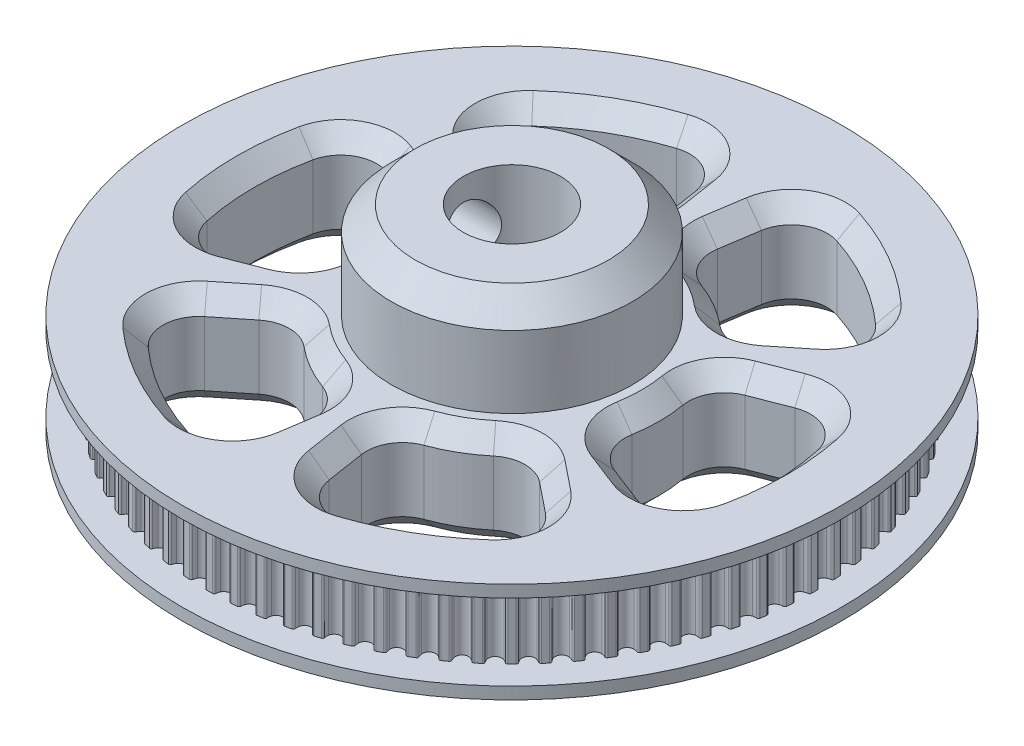
from build123d import *

# Parameters (mm, degrees)
SKETCH1_R               = 25.464790895
BOSS_EXTRUDE1_DEPTH     = 3.175
CUT_EXTRUDE1_DEPTH      = 37.152341219
CIRPATTERN1_COUNT       = 80
BOSS_EXTRUDE2_START     = 3.175
SKETCH3_R               = 27.464790895
BOSS_EXTRUDE2_DEPTH     = 1
BOSS_EXTRUDE3_START     = -4.175
SKETCH3_2_R             = 27.464790895
BOSS_EXTRUDE3_DEPTH     = 1
CUT_EXTRUDE2_DEPTH      = 40.064819247
CUT_EXTRUDE2_DEPTH_BACK = 40.064819247
SKETCH4_R               = 4.05
CUT_EXTRUDE3_DEPTH      = 40.064819247
CUT_EXTRUDE3_DEPTH_BACK = 40.064819247
FILLET2_R               = 3
CHAMFER1_SIZE           = 1.5
BOSS_EXTRUDE4_START     = 8
SKETCH6_R               = 10.05
SKETCH6_R_2             = 4.05
BOSS_EXTRUDE4_DEPTH     = 8
CUT_EXTRUDE4_REACH      = 42.705
CUT_EXTRUDE4_END_RADIUS = 10.05
SKETCH7_R               = 2.403599608
CHAMFER2_SIZE           = 2


with BuildPart() as part:
    # Sketch1 → Boss-Extrude1 (new, symmetric)
    with BuildSketch(Plane(origin=(0, 0, 0), x_dir=(1, 0, 0), z_dir=(0, 1, 0))):
        with Locations(Location((0, 0, 0), (0, 0, 270))):
            Circle(SKETCH1_R)
    extrude(amount=BOSS_EXTRUDE1_DEPTH, both=True)

    # Sketch2 → Cut-Extrude1 (cut, symmetric)
    with BuildSketch(Plane(origin=(0, 0, 0), x_dir=(1, 0, 0), z_dir=(0, 1, 0))):
        with BuildLine():
            Line((0, 25.210790895), (0, 25.464790895))
            ThreePointArc((0, 25.464790895), (0.999742999, 25.445158464), (1.997944466, 25.386291443))
            Line((1.997944466, 25.386291443), (1.978015856, 25.13307444))
            ThreePointArc((1.978015856, 25.13307444), (1.855662402, 25.142404312), (1.733264986, 25.151138543))
            ThreePointArc((1.733264986, 25.151138543), (1.631053055, 25.120045225), (1.575460914, 25.028811529))
            ThreePointArc((1.575460914, 25.028811529), (1.533948478, 24.874656845), (1.468433356, 24.729072788))
            ThreePointArc((1.468433356, 24.729072788), (0.960326144, 24.441932511), (0.476314023, 24.768053263))
            ThreePointArc((0.476314023, 24.768053263), (0.422423256, 24.91832879), (0.393133626, 25.075265295))
            ThreePointArc((0.393133626, 25.075265295), (0.344870971, 25.170579456), (0.245413678, 25.20959638))
            ThreePointArc((0.245413678, 25.20959638), (0.122708293, 25.210492264), (0, 25.210790895))
        make_face()
    cut_extrude1 = extrude(amount=CUT_EXTRUDE1_DEPTH, both=True, mode=Mode.SUBTRACT)

    # CirPattern1: Cut-Extrude1 ×80 about axis
    cirpattern1_axis = Axis((0, 0, 0), (0, 1, 0))
    for i in range(1, CIRPATTERN1_COUNT):
        add(cut_extrude1.rotate(cirpattern1_axis, i * 360 / CIRPATTERN1_COUNT), mode=Mode.SUBTRACT)

    # Sketch3 → Boss-Extrude2 (add)
    with BuildSketch(Plane(origin=(0, 0, 0), x_dir=(1, 0, 0), z_dir=(0, 1, 0)).offset(BOSS_EXTRUDE2_START)):
        with Locations(Location((0, 0, 0), (0, 0, 270))):
            Circle(SKETCH3_R)
    extrude(amount=BOSS_EXTRUDE2_DEPTH)

    # Sketch3<2> → Boss-Extrude3 (add)
    with BuildSketch(Plane(origin=(0, 0, 0), x_dir=(1, 0, 0), z_dir=(0, 1, 0)).offset(BOSS_EXTRUDE3_START)):
        with Locations(Location((0, 0, 0), (0, 0, 270))):
            Circle(SKETCH3_2_R)
    extrude(amount=BOSS_EXTRUDE3_DEPTH)

    # Sketch4 → Cut-Extrude2 (cut, two sides: drawn at the far end of the back side and taken through both)
    with BuildSketch(Plane(origin=(0, 0, 0), x_dir=(1, 0, 0), z_dir=(0, 1, 0)).offset(-CUT_EXTRUDE2_DEPTH_BACK)):
        with Locations(Location((0, 0, 0), (0, 0, 270))):
            Circle(SKETCH4_R)
    extrude(amount=CUT_EXTRUDE2_DEPTH + CUT_EXTRUDE2_DEPTH_BACK, mode=Mode.SUBTRACT)

    # Sketch5 → Cut-Extrude3 (cut, two sides: drawn at the far end of the back side and taken through both)
    with BuildSketch(Plane(origin=(0, 0, 0), x_dir=(1, 0, 0), z_dir=(0, 1, 0)).offset(-CUT_EXTRUDE3_DEPTH_BACK)):
        with BuildLine():
            ThreePointArc((-9.590119923, 7.701921829), (-6.15, 10.652112467), (-1.875, 12.156248393))
            Line((-1.875, 12.156248393), (-3.272071783, 21.213929254))
            ThreePointArc((-3.272071783, 21.213929254), (-10.732395447, 18.589054202), (-16.735765757, 13.440661914))
            Line((-16.735765757, 13.440661914), (-9.590119923, 7.701921829))
        make_face()
        with BuildLine():
            Line((3.272071783, 21.213929254), (1.875, 12.156248393))
            ThreePointArc((1.875, 12.156248393), (6.15, 10.652112467), (9.590119923, 7.701921829))
            Line((9.590119923, 7.701921829), (16.735765757, 13.440661914))
            ThreePointArc((16.735765757, 13.440661914), (10.732395447, 18.589054202), (3.272071783, 21.213929254))
        make_face()
        with BuildLine():
            Line((20.00783754, 7.77326734), (11.465119923, 4.454326565))
            ThreePointArc((11.465119923, 4.454326565), (12.089478381, 2.265946264), (12.3, 0))
            ThreePointArc((12.3, 0), (12.089478381, -2.265946264), (11.465119923, -4.454326565))
            Line((11.465119923, -4.454326565), (20.00783754, -7.77326734))
            ThreePointArc((20.00783754, -7.77326734), (21.097408575, -3.954314044), (21.464790895, 0))
            ThreePointArc((21.464790895, 0), (21.097408575, 3.954314044), (20.00783754, 7.77326734))
        make_face()
        with BuildLine():
            Line((-20.00783754, -7.77326734), (-11.465119923, -4.454326565))
            ThreePointArc((-11.465119923, -4.454326565), (-12.3, 0), (-11.465119923, 4.454326565))
            Line((-11.465119923, 4.454326565), (-20.00783754, 7.77326734))
            ThreePointArc((-20.00783754, 7.77326734), (-21.464790895, 0), (-20.00783754, -7.77326734))
        make_face()
        with BuildLine():
            Line((-3.272071783, -21.213929254), (-1.875, -12.156248393))
            ThreePointArc((-1.875, -12.156248393), (-6.15, -10.652112467), (-9.590119923, -7.701921829))
            Line((-9.590119923, -7.701921829), (-16.735765757, -13.440661914))
            ThreePointArc((-16.735765757, -13.440661914), (-10.732395447, -18.589054202), (-3.272071783, -21.213929254))
        make_face()
        with BuildLine():
            Line((16.735765757, -13.440661914), (9.590119923, -7.701921829))
            ThreePointArc((9.590119923, -7.701921829), (6.15, -10.652112467), (1.875, -12.156248393))
            Line((1.875, -12.156248393), (3.272071783, -21.213929254))
            ThreePointArc((3.272071783, -21.213929254), (10.732395447, -18.589054202), (16.735765757, -13.440661914))
        make_face()
    extrude(amount=CUT_EXTRUDE3_DEPTH + CUT_EXTRUDE3_DEPTH_BACK, mode=Mode.SUBTRACT)

    # Fillet2
    fillet2_edges = [part.edges().sort_by_distance(p)[0] for p in [
        (11.465119923, 0, 4.454326565),
        (11.465119923, 0, -4.454326565),
        (20.00783754, 0, -7.77326734),
        (20.00783754, 0, 7.77326734),
        (9.590119923, 0, -7.701921829),
        (1.875, 0, -12.156248393),
        (3.272071783, 0, -21.213929254),
        (16.735765757, 0, -13.440661914),
        (-9.590119923, 0, 7.701921829),
        (-1.875, 0, 12.156248393),
        (-3.272071783, 0, 21.213929254),
        (-16.735765757, 0, 13.440661914),
        (-11.465119923, 0, -4.454326565),
        (-11.465119923, 0, 4.454326565),
        (-20.00783754, 0, 7.77326734),
        (-20.00783754, 0, -7.77326734),
        (1.875, 0, 12.156248393),
        (9.590119923, 0, 7.701921829),
        (16.735765757, 0, 13.440661914),
        (3.272071783, 0, 21.213929254),
        (-1.875, 0, -12.156248393),
        (-9.590119923, 0, -7.701921829),
        (-16.735765757, 0, -13.440661914),
        (-3.272071783, 0, -21.213929254),
    ]]
    fillet(fillet2_edges, radius=FILLET2_R)

    # Chamfer1
    chamfer1_edges = [part.edges().sort_by_distance(p)[0] for p in [
        (12.3, -4.175, 0),
        (12.3, 4.175, 0),
        (15.483716074, -4.175, -6.01559585),
        (15.483716074, 4.175, -6.01559585),
        (21.464790895, -4.175, 0),
        (21.464790895, 4.175, 0),
        (15.483716074, -4.175, 6.01559585),
        (15.483716074, 4.175, 6.01559585),
        (-6.15, -4.175, 10.652112467),
        (-6.15, 4.175, 10.652112467),
        (-2.532199212, -4.175, 16.41708939),
        (-2.532199212, 4.175, 16.41708939),
        (-10.732395447, -4.175, 18.589054202),
        (-10.732395447, 4.175, 18.589054202),
        (-12.951516862, -4.175, 10.40149354),
        (-12.951516862, 4.175, 10.40149354),
        (6.15, -4.175, 10.652112467),
        (6.15, 4.175, 10.652112467),
        (12.951516862, -4.175, 10.40149354),
        (12.951516862, 4.175, 10.40149354),
        (10.732395447, -4.175, 18.589054202),
        (10.732395447, 4.175, 18.589054202),
        (2.532199212, -4.175, 16.41708939),
        (2.532199212, 4.175, 16.41708939),
        (-6.15, -4.175, -10.652112467),
        (-6.15, 4.175, -10.652112467),
        (-12.951516862, -4.175, -10.40149354),
        (-12.951516862, 4.175, -10.40149354),
        (-12.3, -4.175, 0),
        (-12.3, 4.175, 0),
        (-15.483716074, -4.175, 6.01559585),
        (-15.483716074, 4.175, 6.01559585),
        (-21.464790895, -4.175, 0),
        (-21.464790895, 4.175, 0),
        (-15.483716074, -4.175, -6.01559585),
        (-15.483716074, 4.175, -6.01559585),
        (10.732395447, -4.175, -18.589054202),
        (10.732395447, 4.175, -18.589054202),
        (12.951516862, -4.175, -10.40149354),
        (12.951516862, 4.175, -10.40149354),
        (6.15, -4.175, -10.652112467),
        (6.15, 4.175, -10.652112467),
        (2.532199212, -4.175, -16.41708939),
        (2.532199212, 4.175, -16.41708939),
        (-10.732395447, -4.175, -18.589054202),
        (-10.732395447, 4.175, -18.589054202),
        (-2.532199212, -4.175, -16.41708939),
        (-2.532199212, 4.175, -16.41708939),
        (12.457999198, 4.175, -4.110543312),
        (12.457999198, -4.175, -4.110543312),
        (19.498078649, 4.175, -6.439491141),
        (19.498078649, -4.175, -6.439491141),
        (19.498078649, 4.175, 6.439491141),
        (19.498078649, -4.175, 6.439491141),
        (12.457999198, 4.175, 4.110543312),
        (12.457999198, -4.175, 4.110543312),
        (-2.669164667, 4.175, 12.844215442),
        (-2.669164667, -4.175, 12.844215442),
        (-4.172276409, 4.175, 20.105577005),
        (-4.172276409, -4.175, 20.105577005),
        (-15.32580224, 4.175, 13.666085865),
        (-15.32580224, -4.175, 13.666085865),
        (-9.788834531, 4.175, 8.73367213),
        (-9.788834531, -4.175, 8.73367213),
        (9.788834531, 4.175, 8.73367213),
        (9.788834531, -4.175, 8.73367213),
        (15.32580224, 4.175, 13.666085865),
        (15.32580224, -4.175, 13.666085865),
        (4.172276409, 4.175, 20.105577005),
        (4.172276409, -4.175, 20.105577005),
        (2.669164667, 4.175, 12.844215442),
        (2.669164667, -4.175, 12.844215442),
        (-9.788834531, 4.175, -8.73367213),
        (-9.788834531, -4.175, -8.73367213),
        (-12.457999198, 4.175, 4.110543312),
        (-12.457999198, -4.175, 4.110543312),
        (-19.498078649, 4.175, 6.439491141),
        (-19.498078649, -4.175, 6.439491141),
        (-12.457999198, 4.175, -4.110543312),
        (-12.457999198, -4.175, -4.110543312),
        (15.32580224, 4.175, -13.666085865),
        (15.32580224, -4.175, -13.666085865),
        (9.788834531, 4.175, -8.73367213),
        (9.788834531, -4.175, -8.73367213),
        (-19.498078649, 4.175, -6.439491141),
        (-19.498078649, -4.175, -6.439491141),
        (2.669164667, 4.175, -12.844215442),
        (2.669164667, -4.175, -12.844215442),
        (4.172276409, 4.175, -20.105577005),
        (4.172276409, -4.175, -20.105577005),
        (-4.172276409, 4.175, -20.105577005),
        (-4.172276409, -4.175, -20.105577005),
        (-2.669164667, 4.175, -12.844215442),
        (-2.669164667, -4.175, -12.844215442),
        (-15.32580224, 4.175, -13.666085865),
        (-15.32580224, -4.175, -13.666085865),
    ]]
    chamfer(chamfer1_edges, length=CHAMFER1_SIZE)

    # Sketch6 → Boss-Extrude4 (add)
    with BuildSketch(Plane(origin=(0, 4.175, 0), x_dir=(1, 0, 0), z_dir=(0, 1, 0)).offset(BOSS_EXTRUDE4_START)):
        with Locations(Location((0, 0, 0), (0, 0, 270))):
            Circle(SKETCH6_R)
        with Locations(Location((0, 0, 0), (0, 0, 270))):
            Circle(SKETCH6_R_2, mode=Mode.SUBTRACT)
    extrude(amount=-BOSS_EXTRUDE4_DEPTH)

    # Cut-Extrude4: up to this cylinder (the profile starts inside it)
    cut_extrude4_end = Plane(origin=(0, 7.887303, 0), z_dir=(0, -1, 0)) * Cylinder(CUT_EXTRUDE4_END_RADIUS, 106.51, mode=Mode.PRIVATE)
    # Sketch7 → Cut-Extrude4 (cut, up to the surface)
    with BuildSketch(Plane(origin=(0, 0, 0), x_dir=(0, 0, -1), z_dir=(1, 0, 0)), mode=Mode.PRIVATE) as cut_extrude4_sk1:
        with Locations((0, 7.88730307)):
            Circle(SKETCH7_R)
    cut_extrude4_tool1 = extrude(cut_extrude4_sk1.sketch, amount=-CUT_EXTRUDE4_REACH, mode=Mode.PRIVATE) & cut_extrude4_end
    add(cut_extrude4_tool1.solids().sort_by_distance((0, 7.887303, 0))[0], mode=Mode.SUBTRACT)

    # Chamfer2
    # the kernel refuses this chamfer: 2 mm, written as the material it takes off along each edge
    with BuildSketch(Plane(origin=(0, 12.175, 0), x_dir=(0, 0, 1), z_dir=(-1, 0, 0))) as chamfer2_piece_1:
        Polygon((10.05 - CHAMFER2_SIZE, 0), (10.05, -CHAMFER2_SIZE), (10.05, 0), align=None)
    revolve(axis=Axis((0, 12.175, 0), (0, 1, 0)), mode=Mode.SUBTRACT)


solid = part.part
